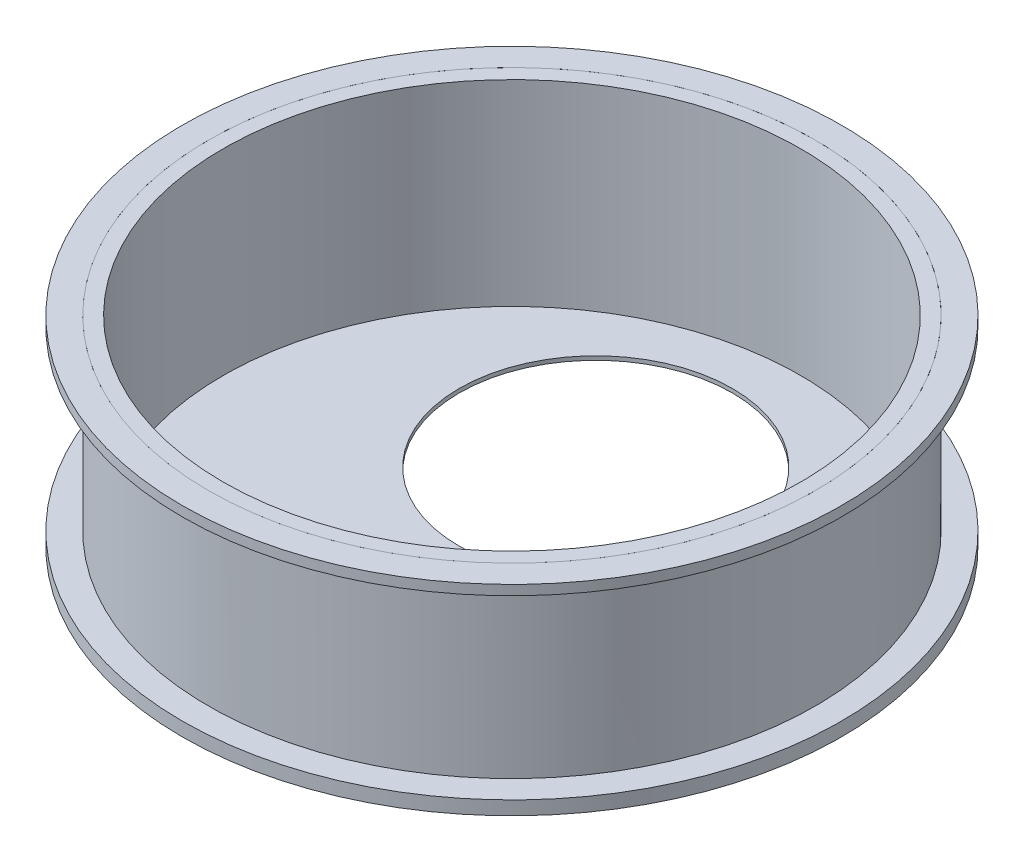
from build123d import *

# Parameters (mm, degrees)
SKETCH1_R           = 1545
SKETCH1_R_2         = 1470
BOSS_EXTRUDE1_DEPTH = 500
SKETCH2_R           = 1677.7105089
SKETCH2_R_2         = 1545
BOSS_EXTRUDE3_DEPTH = 50
BOSS_EXTRUDE4_START = 20
SKETCH4_R           = 1677.7105089
BOSS_EXTRUDE4_DEPTH = 20
SKETCH5_R           = 435.483996726
SKETCH5_R_2         = 695.290957934
CUT_EXTRUDE1_DEPTH  = 265


with BuildPart() as part:
    # Sketch1 → Boss-Extrude1 (new body)
    with BuildSketch(Plane(origin=(0, 0, 0), x_dir=(1, 0, 0), z_dir=(0, 1, 0))):
        Circle(SKETCH1_R)
        Circle(SKETCH1_R_2, mode=Mode.SUBTRACT)
    boss_extrude1 = extrude(amount=BOSS_EXTRUDE1_DEPTH)


with BuildPart() as body_2:
    # Sketch2 → Boss-Extrude3 (new body)
    with BuildSketch(Plane(origin=(0, 500, 0), x_dir=(1, 0, 0), z_dir=(0, 1, 0))):
        Circle(SKETCH2_R)
        Circle(SKETCH2_R_2, mode=Mode.SUBTRACT)
    boss_extrude3 = extrude(amount=-BOSS_EXTRUDE3_DEPTH)


with BuildPart() as part_1:
    add(part.part)

    # Mirror1: Boss-Extrude1, Boss-Extrude3 across plane
    add(boss_extrude1.mirror(Plane.ZX))
    add(boss_extrude3.mirror(Plane.ZX))

    # Sketch4 → Boss-Extrude4 (add)
    with BuildSketch(Plane(origin=(0, -500, 0), x_dir=(-1, 0, 0), z_dir=(0, -1, 0)).offset(BOSS_EXTRUDE4_START)):
        Circle(SKETCH4_R)
    extrude(amount=-BOSS_EXTRUDE4_DEPTH)

    # Sketch5 → Cut-Extrude1 (cut)
    with BuildSketch(Plane(origin=(0, -520, 0), x_dir=(-1, 0, 0), z_dir=(0, -1, 0))):
        with Locations((116.801054632, -733.8016542)):
            Circle(SKETCH5_R)
        with Locations((116.801054632, 543.616562697)):
            Circle(SKETCH5_R_2)
    extrude(amount=-CUT_EXTRUDE1_DEPTH, mode=Mode.SUBTRACT)


solid = Compound([body_2.part, part_1.part])
